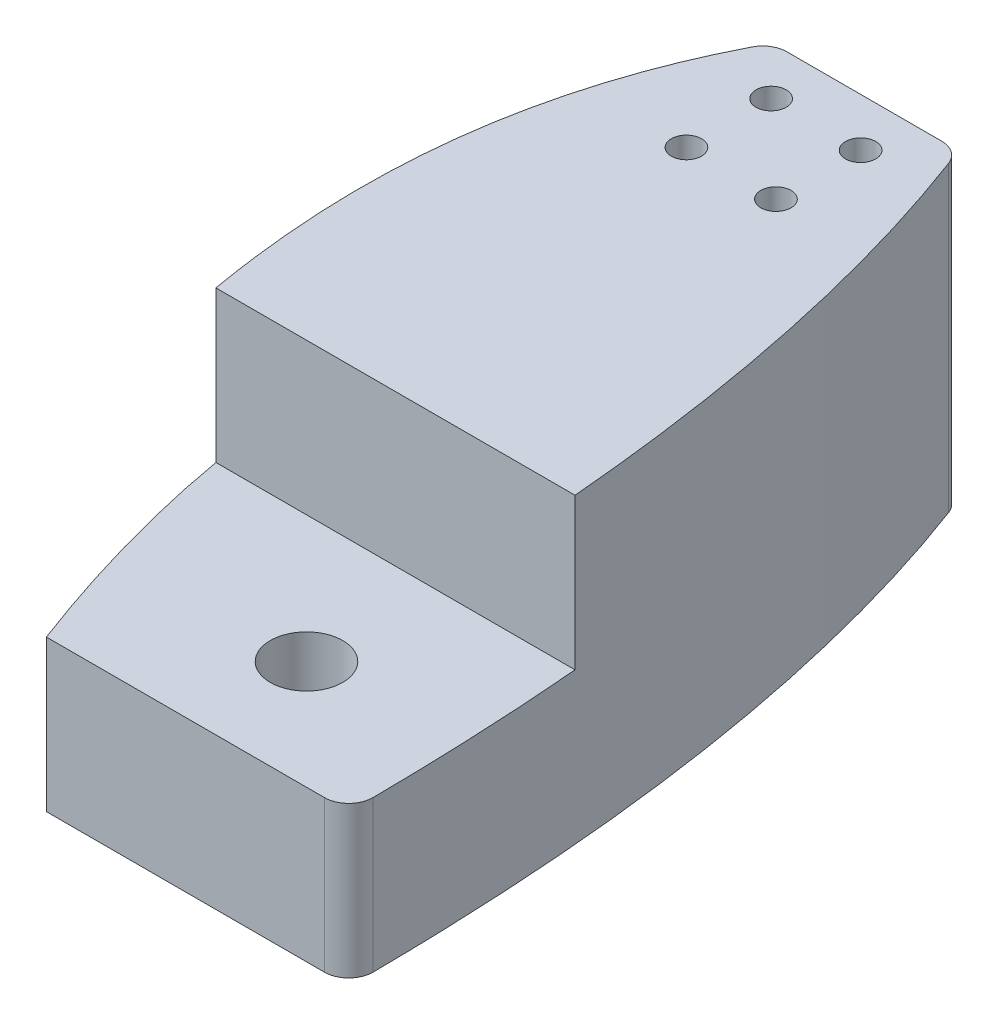
from build123d import *

# Parameters (mm, degrees)
SKETCH_1_W               = 25
SKETCH_1_H               = 25
EXTRUDE_1_DEPTH          = 60
EXTRUDE_4_DEPTH          = 25
CUT_EXTRUDE_START        = -25
CUT_EXTRUDE_4_DEPTH      = 25
SKETCH_4_W               = 41.211163986
SKETCH_4_H               = 12.5
CUT_EXTRUDE_2_DEPTH      = 19.5
SKETCH_2_R               = 3
CUT_EXTRUDE_1_DEPTH      = 36.406845426
FILLET_1_R               = 2
SKETCH_6_W               = 3.397693812
SKETCH_6_H               = 8.5
SKETCH_6_H_2             = 17
CUT_EXTRUDE_5_DEPTH      = 15
CUT_EXTRUDE_6_DEPTH      = 31
CUT_EXTRUDE_6_DEPTH_BACK = 10
SKETCH_7_R               = 1.25
FILLET_2_R               = 2


# Read off the part's stored shape, not the designer's step: 컷-돌출4
with BuildPart() as part:
    # 스케치1 → 보스-돌출1 (new body)
    with BuildSketch(Plane.XY):
        Rectangle(SKETCH_1_W, SKETCH_1_H)
    extrude(amount=EXTRUDE_1_DEPTH)

    # 스케치5 → 보스-돌출4 (add)
    with BuildSketch(Plane(origin=(0, 12.5, 0), x_dir=(1, 0, 0), z_dir=(0, 1, 0))):
        with BuildLine():
            add(Edge.make_bspline(
                [(2.878979614, 0), (12.5, -24.697131942), (12.5, -60)],
                knots=[0, 0, 0, 1, 1, 1], degree=2))
            Line((2.878979614, 0), (-12.5, 0))
            Line((-12.5, 0), (-12.5, -60))
            Line((-12.5, -60), (12.5, -60))
        make_face()
        with BuildLine():
            Line((-12.5, -60), (-12.5, 0))
            add(Edge.make_bspline(
                [(-12.5, 0), (-25.857752506, -24.697131942), (-12.5, -60)],
                knots=[0, 0, 0, 1, 1, 1], degree=2))
        make_face()
    extrude(amount=-EXTRUDE_4_DEPTH)

    # 컷-돌출4 outline → 컷-돌출4 (cut)
    with BuildSketch(Plane(origin=(0, 12.5, 0), x_dir=(1, 0, 0), z_dir=(0, 1, 0)).offset(CUT_EXTRUDE_START)):
        with BuildLine():
            Line((12.5, 0), (2.878979614, 0))
            add(Edge.make_bspline(
                [(2.878979614, 0), (12.5, -24.697131942), (12.5, -60)],
                knots=[0, 0, 0, 1, 1, 1], degree=2))
            Line((12.5, -60), (12.5, 0))
        make_face()
    extrude(amount=CUT_EXTRUDE_4_DEPTH, mode=Mode.SUBTRACT)

    # 스케치4 → 컷-돌출2 (cut)
    with BuildSketch(Plane.XY.offset(60)):
        with Locations((-1.817465194, 6.25)):
            Rectangle(SKETCH_4_W, SKETCH_4_H)
    extrude(amount=-CUT_EXTRUDE_2_DEPTH, mode=Mode.SUBTRACT)

    # 스케치2 → 컷-돌출1 (cut)
    with BuildSketch(Plane(origin=(0, 12.5, 0), x_dir=(1, 0, 0), z_dir=(0, 1, 0))):
        with Locations(Location((0, -51, 0), (0, 0, 270))):
            Circle(SKETCH_2_R)
    extrude(amount=-CUT_EXTRUDE_1_DEPTH, mode=Mode.SUBTRACT)

    # 필렛1
    fillet_1_edges = [part.edges().sort_by_distance(p)[0] for p in [
        (2.878979614, 0, 0),
        (-12.5, 0, 0),
    ]]
    fillet(fillet_1_edges, radius=FILLET_1_R)

    # 스케치6 → 컷-돌출5 (cut)
    with BuildSketch(Plane(origin=(0, 0, 0), x_dir=(-1, 0, 0), z_dir=(0, 0, -1))):
        with Locations((1.196360316, 4.25)):
            Rectangle(SKETCH_6_W, SKETCH_6_H)
        with Locations((1.196360316, -4.25)):
            Rectangle(SKETCH_6_W, SKETCH_6_H)
        with Locations((8.594054128, 0)):
            Rectangle(SKETCH_6_W, SKETCH_6_H_2)
    extrude(amount=-CUT_EXTRUDE_5_DEPTH, mode=Mode.SUBTRACT)

    # 스케치7 → 컷-돌출6 (cut, two sides: drawn at the far end of the back side and taken through both)
    with BuildSketch(Plane.XZ.offset(-8.5).offset(-CUT_EXTRUDE_6_DEPTH_BACK)):
        with Locations(Location((-1.196360316, 4, 0), (0, 0, 90))):
            Circle(SKETCH_7_R)
        with Locations(Location((-1.196360316, 11, 0), (0, 0, 90))):
            Circle(SKETCH_7_R)
        with Locations(Location((-8.594054128, 4, 0), (0, 0, 90))):
            Circle(SKETCH_7_R)
        with Locations(Location((-8.594054128, 11, 0), (0, 0, 90))):
            Circle(SKETCH_7_R)
    extrude(amount=CUT_EXTRUDE_6_DEPTH + CUT_EXTRUDE_6_DEPTH_BACK, mode=Mode.SUBTRACT)

    # 필렛2
    fillet_2_edges = [part.edges().sort_by_distance(p)[0] for p in [
        (12.5, -6.25, 60),
    ]]
    fillet(fillet_2_edges, radius=FILLET_2_R)


solid = part.part
